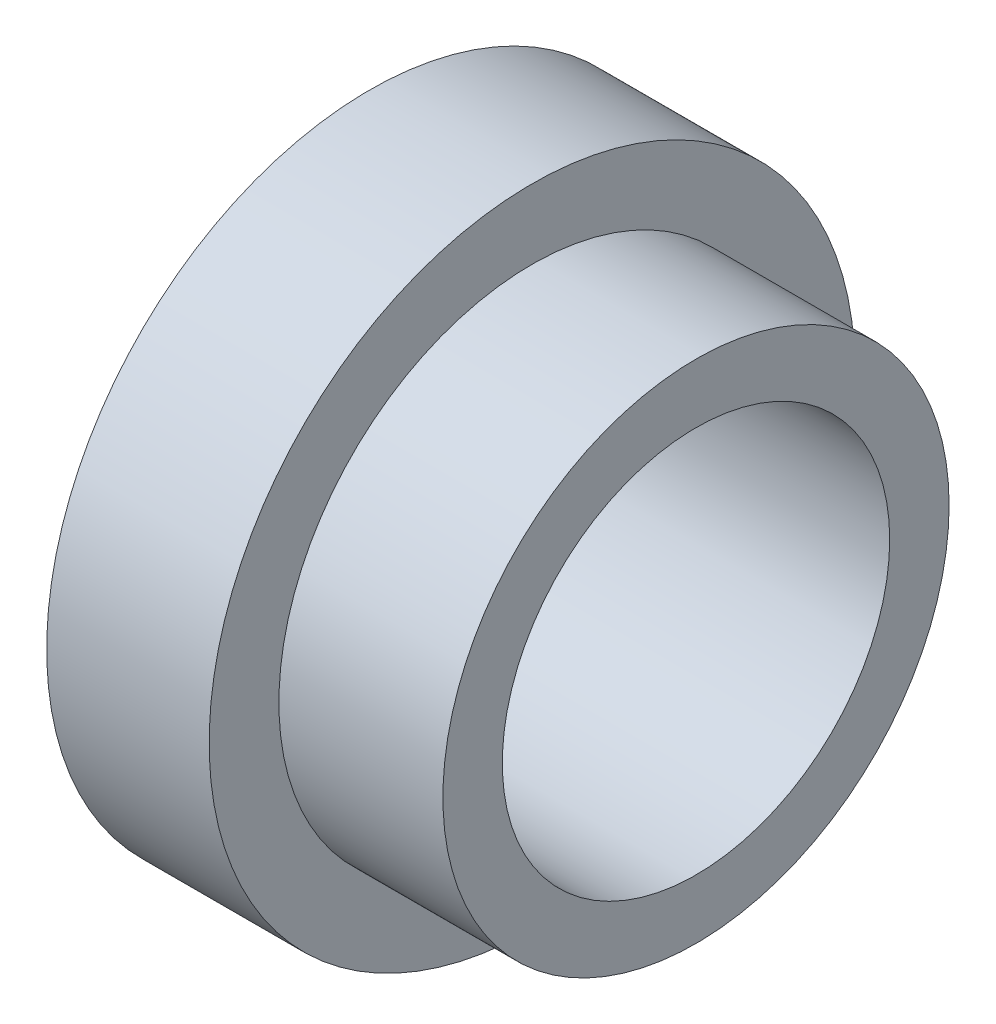
from build123d import *

# Parameters (mm, degrees)
SKETCH1_R           = 12.5
SKETCH1_R_2         = 7.5
BOSS_EXTRUDE1_DEPTH = 6.29
SKETCH2_R           = 9.8
SKETCH2_R_2         = 7.5
BOSS_EXTRUDE2_DEPTH = 6.35


with BuildPart() as part:
    # Sketch1 → Boss-Extrude1 (new body)
    with BuildSketch(Plane(origin=(0, 0, 0), x_dir=(0, 0, -1), z_dir=(1, 0, 0))):
        Circle(SKETCH1_R)
        Circle(SKETCH1_R_2, mode=Mode.SUBTRACT)
    extrude(amount=BOSS_EXTRUDE1_DEPTH)

    # Sketch2 → Boss-Extrude2 (add)
    with BuildSketch(Plane(origin=(6.29, 0, 0), x_dir=(0, 0, -1), z_dir=(1, 0, 0))):
        Circle(SKETCH2_R)
        Circle(SKETCH2_R_2, mode=Mode.SUBTRACT)
    extrude(amount=BOSS_EXTRUDE2_DEPTH)


solid = part.part
